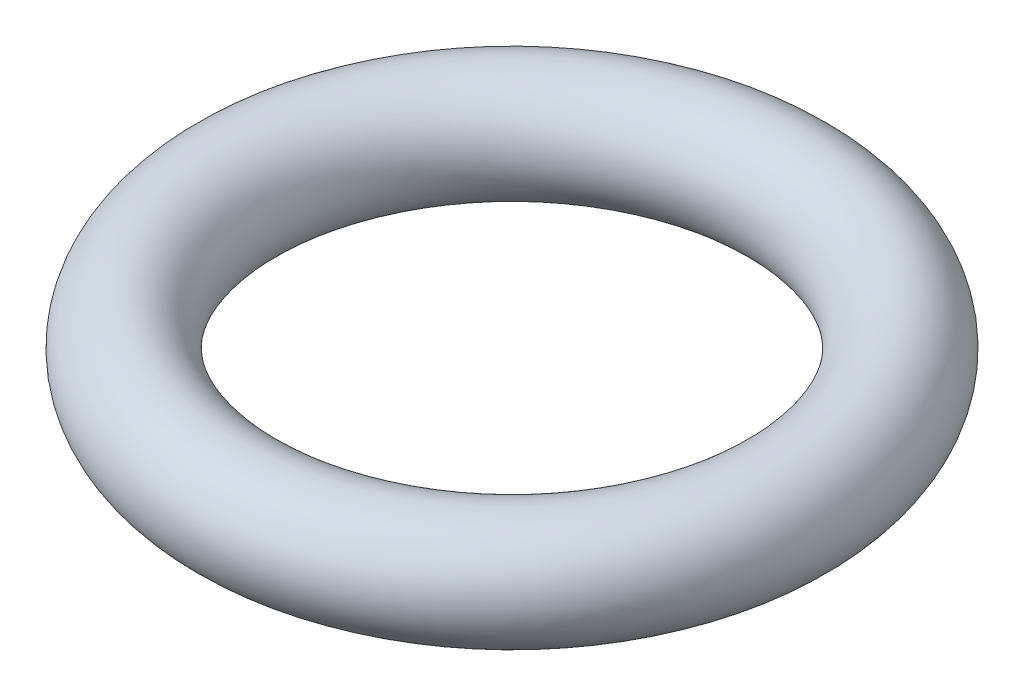
from build123d import *

# Parameters (mm, degrees)
SKETCH1_R = 10


with BuildPart() as part:
    # Sketch1 → Revolve1 (revolve)
    with BuildSketch(Plane.XY):
        with Locations((-50, 0)):
            Circle(SKETCH1_R)
    revolve(axis=Axis((0, 0, 0), (0, 1, 0)))


solid = part.part
